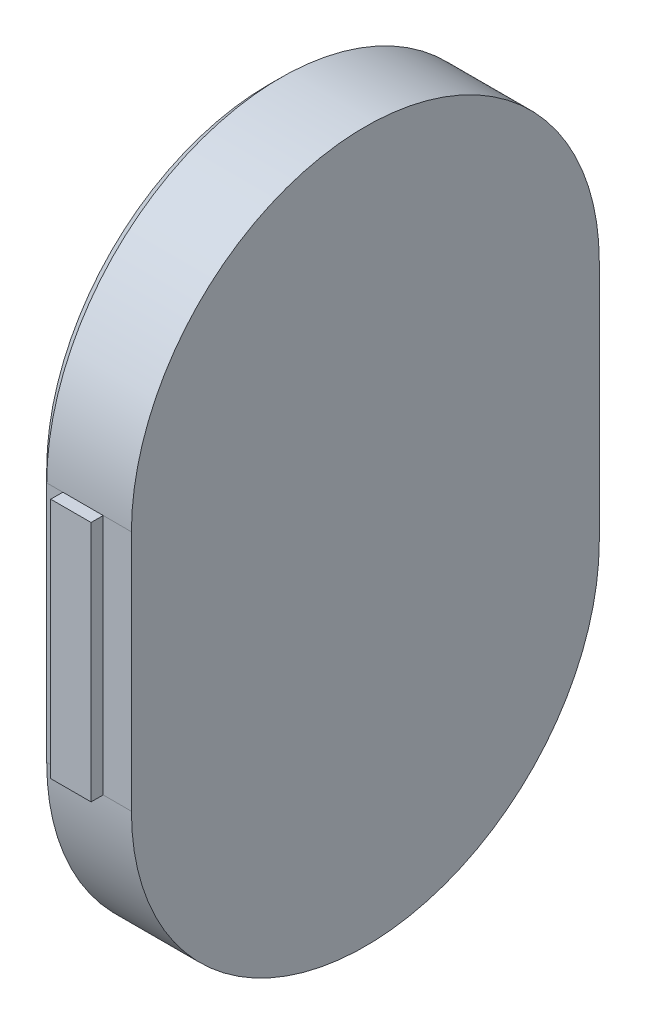
from build123d import *

# Parameters (mm, degrees)
BOSS_EXTRUDE1_START = -38
BOSS_EXTRUDE1_DEPTH = 2.4
CHAMFER1_SIZE       = 0.3
BOSS_EXTRUDE2_START = 82.2
SKETCH2_W           = 1
SKETCH2_H           = 6
BOSS_EXTRUDE2_DEPTH = 0.31
BOSS_EXTRUDE3_START = 94.09
SKETCH3_W           = 1
SKETCH3_H           = 6
BOSS_EXTRUDE3_DEPTH = 0.31
BOSS_EXTRUDE4_START = 86.8
SKETCH4_W           = 0.7
SKETCH4_H           = 1.3
BOSS_EXTRUDE4_DEPTH = 3


with BuildPart() as part:
    # Sketch1 → Boss-Extrude1 (new body)
    with BuildSketch(Plane(origin=(0, 0, 0), x_dir=(0, 0, -1), z_dir=(1, 0, 0)).offset(BOSS_EXTRUDE1_START)):
        with BuildLine():
            Line((-94.1, 53), (-94.1, 59))
            ThreePointArc((-94.1, 59), (-92.401219331, 63.101219331), (-88.3, 64.8))
            ThreePointArc((-88.3, 64.8), (-84.198780669, 63.101219331), (-82.5, 59))
            Line((-82.5, 59), (-82.5, 53))
            ThreePointArc((-82.5, 53), (-84.198780669, 48.898780669), (-88.3, 47.2))
            ThreePointArc((-88.3, 47.2), (-92.401219331, 48.898780669), (-94.1, 53))
        make_face()
    extrude(amount=BOSS_EXTRUDE1_DEPTH)

    # Chamfer1
    chamfer1_edges = [part.edges().sort_by_distance(p)[0] for p in [
        (-38, 47.2, 88.3),
        (-38, 56, 82.5),
        (-38, 56, 94.1),
        (-38, 64.8, 88.3),
    ]]
    chamfer(chamfer1_edges, length=CHAMFER1_SIZE)

    # Sketch2 → Boss-Extrude2 (add)
    with BuildSketch(Plane.XY.offset(BOSS_EXTRUDE2_START)):
        with Locations((-36.8, 56)):
            Rectangle(SKETCH2_W, SKETCH2_H)
    extrude(amount=BOSS_EXTRUDE2_DEPTH)

    # Sketch3 → Boss-Extrude3 (add)
    with BuildSketch(Plane.XY.offset(BOSS_EXTRUDE3_START)):
        with Locations((-36.8, 56)):
            Rectangle(SKETCH3_W, SKETCH3_H)
    extrude(amount=BOSS_EXTRUDE3_DEPTH)


with BuildPart() as body_2:
    # Sketch4 → Boss-Extrude4 (new body)
    with BuildSketch(Plane.XY.offset(BOSS_EXTRUDE4_START)):
        with Locations((-37.75, 47.75)):
            Rectangle(SKETCH4_W, SKETCH4_H)
    extrude(amount=BOSS_EXTRUDE4_DEPTH)


with BuildPart() as part_1:
    add(part.part)

    # Combine1: cut body 2
    add(body_2.part, mode=Mode.SUBTRACT)


solid = part_1.part
